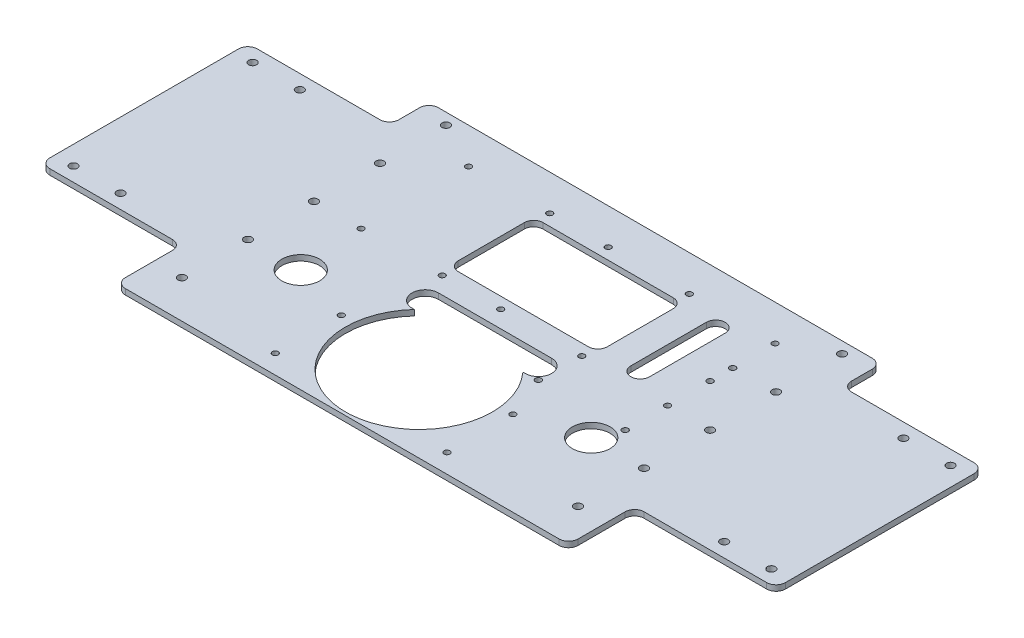
from build123d import *

# Parameters (mm, degrees)
SKETCH_1_W          = 240
SKETCH_1_H          = 166
EXTRUDE_1270_DEPTH  = 3
SKETCH_4_R          = 2.1
SKETCH_4_R_2        = 1.55
CUT_EXTRUDE_3_DEPTH = 251.068459046
SKETCH_5_R          = 1.55
SKETCH_5_R_2        = 10
SKETCH_5_W          = 79
SKETCH_5_H          = 45
CUT_EXTRUDE_4_DEPTH = 251.068459046
SKETCH_6_W          = 75
SKETCH_6_H          = 110
SKETCH_6_R          = 2.1
EXTRUDE_1_DEPTH     = 3
FILLET_1_R          = 5
SKETCH_8_R          = 39
CUT_EXTRUDE_6_DEPTH = 10
CUT_EXTRUDE_START   = -10
SKETCH_9_R          = 1.55
SKETCH_9_R_2        = 1.6
CUT_EXTRUDE_7_DEPTH = 10


with BuildPart() as part:
    # 草图1 → Extrude 1270 (new body)
    with BuildSketch(Plane(origin=(0, 0, 0), x_dir=(1, 0, 0), z_dir=(0, 1, 0))):
        with Locations((31.575924772, -115.871750732)):
            Rectangle(SKETCH_1_W, SKETCH_1_H)
    extrude(amount=EXTRUDE_1270_DEPTH)

    # 草图4 → 切除-拉伸3 (cut, through all)
    with BuildSketch(Plane(origin=(0, 3, 0), x_dir=(1, 0, 0), z_dir=(0, 1, 0))):
        with Locations((-73.424075228, -73.871750732)):
            Circle(SKETCH_4_R)
        with Locations((136.575924772, -178.871750732)):
            Circle(SKETCH_4_R)
        with Locations((-73.424075228, -108.871750732)):
            Circle(SKETCH_4_R)
        with Locations((-73.424075228, -143.871750732)):
            Circle(SKETCH_4_R)
        with Locations((-73.424075228, -178.871750732)):
            Circle(SKETCH_4_R)
        with Locations((136.575924772, -143.871750732)):
            Circle(SKETCH_4_R)
        with Locations((136.575924772, -108.871750732)):
            Circle(SKETCH_4_R)
        with Locations((136.575924772, -73.871750732)):
            Circle(SKETCH_4_R)
        with Locations((-73.424075228, -38.871750732)):
            Circle(SKETCH_4_R)
        with Locations((136.575924772, -38.871750732)):
            Circle(SKETCH_4_R)
        with Locations((77.075924772, -188.871750732)):
            Circle(SKETCH_4_R_2)
        with Locations((-13.924075228, -188.871750732)):
            Circle(SKETCH_4_R_2)
        with Locations((77.075924772, -153.871750732)):
            Circle(SKETCH_4_R_2)
        with Locations((-13.924075228, -153.871750732)):
            Circle(SKETCH_4_R_2)
    extrude(amount=-CUT_EXTRUDE_3_DEPTH, mode=Mode.SUBTRACT)

    # 草图5 → 切除-拉伸4 (cut, through all)
    with BuildSketch(Plane(origin=(0, 3, 0), x_dir=(1, 0, 0), z_dir=(0, 1, 0))):
        with Locations((-5.424075228, -51.871750732)):
            Circle(SKETCH_5_R)
        with Locations((68.575924772, -51.871750732)):
            Circle(SKETCH_5_R)
        with Locations((68.575924772, -108.871750732)):
            Circle(SKETCH_5_R)
        with Locations((-5.424075228, -108.871750732)):
            Circle(SKETCH_5_R)
        with Locations((-45.424075228, -143.871750732)):
            Circle(SKETCH_5_R_2)
        with Locations((108.575924772, -143.871750732)):
            Circle(SKETCH_5_R_2)
        with Locations((31.575924772, -80.371750732)):
            Rectangle(SKETCH_5_W, SKETCH_5_H)
        with BuildLine():
            Line((86.075924772, -100.371750732), (86.075924772, -60.371750732))
            ThreePointArc((86.075924772, -60.371750732), (91.075924772, -55.371750732), (96.075924772, -60.371750732))
            Line((96.075924772, -60.371750732), (96.075924772, -100.371750732))
            ThreePointArc((96.075924772, -100.371750732), (91.075924772, -105.371750732), (86.075924772, -100.371750732))
        make_face()
        with BuildLine():
            Line((1.575924772, -117.871750732), (61.575924772, -117.871750732))
            ThreePointArc((61.575924772, -117.871750732), (68.575924772, -124.871750732), (61.575924772, -131.871750732))
            Line((61.575924772, -131.871750732), (41.575924772, -131.871750732))
            ThreePointArc((41.575924772, -131.871750732), (31.575924772, -141.871750732), (21.575924772, -131.871750732))
            Line((21.575924772, -131.871750732), (1.575924772, -131.871750732))
            ThreePointArc((1.575924772, -131.871750732), (-5.424075228, -124.871750732), (1.575924772, -117.871750732))
        make_face()
    extrude(amount=-CUT_EXTRUDE_4_DEPTH, mode=Mode.SUBTRACT)

    # 草图6 → 凸台-拉伸1 (add)
    # profile 1 of 2: a face of its own
    with BuildSketch(Plane(origin=(0, 0, 0), x_dir=(1, 0, 0), z_dir=(0, 1, 0))):
        with Locations((-125.924075228, -108.871750732)):
            Rectangle(SKETCH_6_W, SKETCH_6_H)
        with Locations((-153.424075228, -61.371750732)):
            Circle(SKETCH_6_R, mode=Mode.SUBTRACT)
        with Locations((-153.424075228, -156.371750732)):
            Circle(SKETCH_6_R, mode=Mode.SUBTRACT)
        with Locations((-128.424075228, -61.371750732)):
            Circle(SKETCH_6_R, mode=Mode.SUBTRACT)
        with Locations((-128.424075228, -156.371750732)):
            Circle(SKETCH_6_R, mode=Mode.SUBTRACT)
    # profile 2 of 2: a face of its own
    with BuildSketch(Plane(origin=(0, 0, 0), x_dir=(1, 0, 0), z_dir=(0, 1, 0))):
        with Locations((189.075924772, -108.871750732)):
            Rectangle(SKETCH_6_W, SKETCH_6_H)
        with Locations((216.575924772, -156.371750732)):
            Circle(SKETCH_6_R, mode=Mode.SUBTRACT)
        with Locations((216.575924772, -61.371750732)):
            Circle(SKETCH_6_R, mode=Mode.SUBTRACT)
        with Locations((191.575924772, -156.371750732)):
            Circle(SKETCH_6_R, mode=Mode.SUBTRACT)
        with Locations((191.575924772, -61.371750732)):
            Circle(SKETCH_6_R, mode=Mode.SUBTRACT)
    extrude(amount=EXTRUDE_1_DEPTH)

    # 圆角1
    fillet_1_edges = [part.edges().sort_by_distance(p)[0] for p in [
        (71.075924772, 1.5, 102.871750732),
        (-7.924075228, 1.5, 102.871750732),
        (-7.924075228, 1.5, 57.871750732),
        (71.075924772, 1.5, 57.871750732),
        (151.575924772, 1.5, 32.871750732),
        (-88.424075228, 1.5, 32.871750732),
        (151.575924772, 1.5, 53.871750732),
        (151.575924772, 1.5, 163.871750732),
        (-88.424075228, 1.5, 163.871750732),
        (-88.424075228, 1.5, 53.871750732),
        (226.575924772, 1.5, 53.871750732),
        (226.575924772, 1.5, 163.871750732),
        (151.575924772, 1.5, 198.871750732),
        (-88.424075228, 1.5, 198.871750732),
        (-163.424075228, 1.5, 53.871750732),
        (-163.424075228, 1.5, 163.871750732),
        (41.575924772, 1.5, 131.871750732),
        (21.575924772, 1.5, 131.871750732),
    ]]
    fillet(fillet_1_edges, radius=FILLET_1_R)

    # 草图8 → 切除-拉伸6 (cut)
    with BuildSketch(Plane(origin=(0, 3, 0), x_dir=(1, 0, 0), z_dir=(0, 1, 0))):
        with Locations((31.575924772, -158.205226673)):
            Circle(SKETCH_8_R)
    extrude(amount=-CUT_EXTRUDE_6_DEPTH, mode=Mode.SUBTRACT)

    # 草图9 → 切除-拉伸7 (cut)
    with BuildSketch(Plane.XZ.offset(CUT_EXTRUDE_START)):
        with Locations((68.575924772, 108.871750732)):
            Circle(SKETCH_9_R)
        with Locations((-48.424075228, 108.871750732)):
            Circle(SKETCH_9_R)
        with Locations((25.575924772, 108.871750732)):
            Circle(SKETCH_9_R)
        with Locations((25.575924772, 51.871750732)):
            Circle(SKETCH_9_R)
        with Locations((-48.424075228, 51.871750732)):
            Circle(SKETCH_9_R)
        with Locations((114.075924772, 51.871750732)):
            Circle(SKETCH_9_R)
        with Locations((114.075924772, 74.371750732)):
            Circle(SKETCH_9_R_2)
        with Locations((114.075924772, 86.371750732)):
            Circle(SKETCH_9_R_2)
        with Locations((114.075924772, 108.871750732)):
            Circle(SKETCH_9_R)
        with Locations((114.075924772, 131.371750732)):
            Circle(SKETCH_9_R_2)
        with Locations((68.075924772, 131.371750732)):
            Circle(SKETCH_9_R_2)
    extrude(amount=CUT_EXTRUDE_7_DEPTH, mode=Mode.SUBTRACT)


solid = part.part
